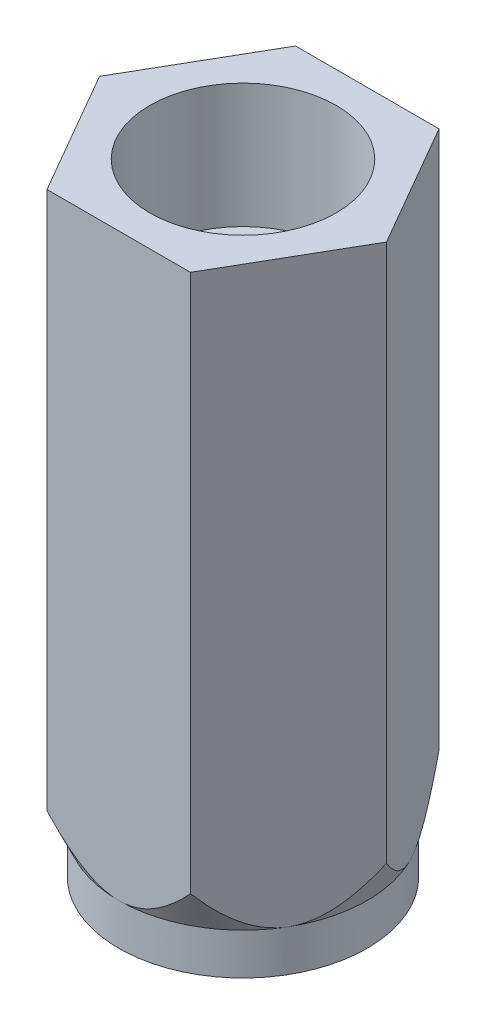
from build123d import *

# Parameters (mm, degrees)
SKETCH1_R           = 2.5
SKETCH1_R_2         = 1.7
BOSS_EXTRUDE1_DEPTH = 2
SKETCH2_R           = 3
SKETCH2_R_2         = 2.25
BOSS_EXTRUDE2_DEPTH = 15
BOSS_EXTRUDE3_DEPTH = 10
BOSS_EXTRUDE4_START = -13
BOSS_EXTRUDE4_DEPTH = 13
CHAMFER1_SIZE       = 1
CHAMFER1_SIZE_2     = 0.46
SKETCH3_R           = 0.5
CUT_EXTRUDE1_DEPTH  = 16.684387141


with BuildPart() as part:
    # Sketch1 → Boss-Extrude1 (new body)
    with BuildSketch(Plane(origin=(0, 0, 0), x_dir=(1, 0, 0), z_dir=(0, 1, 0))):
        with Locations(Location((0, 0, 0), (0, 0, 270))):
            Circle(SKETCH1_R)
        with Locations(Location((0, 0, 0), (0, 0, 270))):
            Circle(SKETCH1_R_2, mode=Mode.SUBTRACT)
    extrude(amount=BOSS_EXTRUDE1_DEPTH)

    # Sketch2 → Boss-Extrude2 (add)
    with BuildSketch(Plane.XZ):
        with Locations(Location((0, 0, 0), (0, 0, 270))):
            Circle(SKETCH2_R)
        with Locations(Location((0, 0, 0), (0, 0, 270))):
            Circle(SKETCH2_R_2, mode=Mode.SUBTRACT)
    extrude(amount=-BOSS_EXTRUDE2_DEPTH)

    # Sketch4 → Boss-Extrude3 (add)
    with BuildSketch(Plane(origin=(0, 2, 0), x_dir=(1, 0, 0), z_dir=(0, 1, 0))):
        with BuildLine():
            Line((-2.25, 0), (-1.7, 0))
            ThreePointArc((-1.7, 0), (0, 1.7), (1.7, 0))
            Line((1.7, 0), (2.25, 0))
            ThreePointArc((2.25, 0), (0, 2.25), (-2.25, 0))
        make_face()
    extrude(amount=BOSS_EXTRUDE3_DEPTH)

    # Sketch5 → Boss-Extrude4 (add)
    with BuildSketch(Plane(origin=(0, 15, 0), x_dir=(1, 0, 0), z_dir=(0, 1, 0)).offset(BOSS_EXTRUDE4_START)):
        with BuildLine():
            ThreePointArc((3, 0), (2.897777479, -0.776457134), (2.598076213, -1.499999997))
            Line((2.598076213, -1.499999997), (3.464101615, 0))
            Line((3.464101615, 0), (2.598076175, 1.500000063))
            ThreePointArc((2.598076175, 1.500000063), (2.897777469, 0.776457171), (3, 0))
        make_face()
        with BuildLine():
            ThreePointArc((0, 3), (1.499999968, 2.59807623), (2.598076175, 1.500000063))
            Line((2.598076175, 1.500000063), (1.732050808, 3))
            Line((1.732050808, 3), (0, 3))
        make_face()
        with BuildLine():
            Line((0, -3), (1.732050808, -3))
            Line((1.732050808, -3), (2.598076213, -1.499999997))
            ThreePointArc((2.598076213, -1.499999997), (1.500000001, -2.598076211), (0, -3))
        make_face()
        with BuildLine():
            Line((-1.732050808, -3), (0, -3))
            ThreePointArc((0, -3), (-1.500000022, -2.598076199), (-2.598076237, -1.499999956))
            Line((-2.598076237, -1.499999956), (-1.732050808, -3))
        make_face()
        with BuildLine():
            Line((-1.732050808, 3), (-2.598076213, 1.499999997))
            ThreePointArc((-2.598076213, 1.499999997), (-1.500000001, 2.598076211), (0, 3))
            Line((0, 3), (-1.732050808, 3))
        make_face()
        with BuildLine():
            Line((-3.464101615, 0), (-2.598076237, -1.499999956))
            ThreePointArc((-2.598076237, -1.499999956), (-3, 2.4e-08), (-2.598076213, 1.499999997))
            Line((-2.598076213, 1.499999997), (-3.464101615, 0))
        make_face()
    extrude(amount=BOSS_EXTRUDE4_DEPTH)

    # Chamfer1
    # the kernel refuses this chamfer: 1, 0.46 mm, written as the material it adds along each edge
    with BuildSketch(Plane(origin=(0, 2, 0), x_dir=(0.8660253915691799, 0, -0.5000000211574483), z_dir=(-0.5000000211574483, 0, -0.8660253915691799))) as chamfer1_piece_1_section:
        Polygon((3, CHAMFER1_SIZE), (3 + CHAMFER1_SIZE_2, 0), (3, 0), align=None)
    chamfer1_piece_1 = revolve(axis=Axis((0, 2, 0), (0, -1, 0)), revolution_arc=60.00000134, mode=Mode.PRIVATE)
    chamfer1_piece_1 = split(chamfer1_piece_1, bisect_by=Plane(origin=(3.362009453, 1.613138891, 0.176828812), z_dir=(-0.8660254037844387, 0, -0.4999999999999999)), keep=Keep.TOP, mode=Mode.PRIVATE)
    chamfer1_piece_1 = split(chamfer1_piece_1, bisect_by=Plane(origin=(3.362009453, 1.613138891, -0.176828812), z_dir=(-0.8660254037844383, 0, 0.5000000000000009)), keep=Keep.TOP, mode=Mode.PRIVATE)
    add(chamfer1_piece_1)
    with BuildSketch(Plane(origin=(0, 2, 0), x_dir=(0, 0, -1), z_dir=(-1, 0, 0))) as chamfer1_piece_2_section:
        Polygon((3, CHAMFER1_SIZE), (3 + CHAMFER1_SIZE_2, 0), (3, 0), align=None)
    chamfer1_piece_2 = revolve(axis=Axis((0, 2, 0), (0, -1, 0)), revolution_arc=59.9999986, mode=Mode.PRIVATE)
    chamfer1_piece_2 = split(chamfer1_piece_2, bisect_by=Plane(origin=(1.527866484, 1.613138891, -3), z_dir=(0, 0, 1)), keep=Keep.TOP, mode=Mode.PRIVATE)
    chamfer1_piece_2 = split(chamfer1_piece_2, bisect_by=Plane(origin=(1.83414297, 1.613138891, -2.823171188), z_dir=(-0.8660254037844383, 0, 0.5000000000000009)), keep=Keep.TOP, mode=Mode.PRIVATE)
    add(chamfer1_piece_2)
    with BuildSketch(Plane(origin=(0, 2, 0), x_dir=(0.8660254043088125, 0, 0.4999999990917579), z_dir=(0.4999999990917579, 0, -0.8660254043088125))) as chamfer1_piece_3_section:
        Polygon((3, CHAMFER1_SIZE), (3 + CHAMFER1_SIZE_2, 0), (3, 0), align=None)
    chamfer1_piece_3 = revolve(axis=Axis((0, 2, 0), (0, -1, 0)), revolution_arc=60.00000006, mode=Mode.PRIVATE)
    chamfer1_piece_3 = split(chamfer1_piece_3, bisect_by=Plane(origin=(1.527866484, 1.613138891, 3), z_dir=(0, 0, -1)), keep=Keep.TOP, mode=Mode.PRIVATE)
    chamfer1_piece_3 = split(chamfer1_piece_3, bisect_by=Plane(origin=(1.83414297, 1.613138891, 2.823171188), z_dir=(-0.8660254037844387, 0, -0.4999999999999999)), keep=Keep.TOP, mode=Mode.PRIVATE)
    add(chamfer1_piece_3)
    with BuildSketch(Plane(origin=(0, 2, 0), x_dir=(0, 0, 1), z_dir=(1, 0, 0))) as chamfer1_piece_4_section:
        Polygon((3, CHAMFER1_SIZE), (3 + CHAMFER1_SIZE_2, 0), (3, 0), align=None)
    chamfer1_piece_4 = revolve(axis=Axis((0, 2, 0), (0, -1, 0)), revolution_arc=60.000000962, mode=Mode.PRIVATE)
    chamfer1_piece_4 = split(chamfer1_piece_4, bisect_by=Plane(origin=(-1.83414297, 1.613138891, 2.823171188), z_dir=(0.8660254037844383, 0, -0.5000000000000007)), keep=Keep.TOP, mode=Mode.PRIVATE)
    chamfer1_piece_4 = split(chamfer1_piece_4, bisect_by=Plane(origin=(-1.527866484, 1.613138891, 3), z_dir=(0, 0, -1)), keep=Keep.TOP, mode=Mode.PRIVATE)
    add(chamfer1_piece_4)
    with BuildSketch(Plane(origin=(0, 2, 0), x_dir=(-0.8660254043087933, 0, -0.4999999990917912), z_dir=(-0.4999999990917912, 0, 0.8660254043087933))) as chamfer1_piece_5_section:
        Polygon((3, CHAMFER1_SIZE), (3 + CHAMFER1_SIZE_2, 0), (3, 0), align=None)
    chamfer1_piece_5 = revolve(axis=Axis((0, 2, 0), (0, -1, 0)), revolution_arc=60.00000006, mode=Mode.PRIVATE)
    chamfer1_piece_5 = split(chamfer1_piece_5, bisect_by=Plane(origin=(-1.527866484, 1.613138891, -3), z_dir=(0, 0, 1)), keep=Keep.TOP, mode=Mode.PRIVATE)
    chamfer1_piece_5 = split(chamfer1_piece_5, bisect_by=Plane(origin=(-1.83414297, 1.613138891, -2.823171188), z_dir=(0.8660254037844388, 0, 0.4999999999999996)), keep=Keep.TOP, mode=Mode.PRIVATE)
    add(chamfer1_piece_5)
    with BuildSketch(Plane(origin=(0, 2, 0), x_dir=(-0.8660254121823108, 0, 0.4999999854544585), z_dir=(0.4999999854544585, 0, 0.8660254121823108))) as chamfer1_piece_6_section:
        Polygon((3, CHAMFER1_SIZE), (3 + CHAMFER1_SIZE_2, 0), (3, 0), align=None)
    chamfer1_piece_6 = revolve(axis=Axis((0, 2, 0), (0, -1, 0)), revolution_arc=59.999998978, mode=Mode.PRIVATE)
    chamfer1_piece_6 = split(chamfer1_piece_6, bisect_by=Plane(origin=(-3.362009453, 1.613138891, -0.176828812), z_dir=(0.8660254037844388, 0, 0.4999999999999996)), keep=Keep.TOP, mode=Mode.PRIVATE)
    chamfer1_piece_6 = split(chamfer1_piece_6, bisect_by=Plane(origin=(-3.362009453, 1.613138891, 0.176828812), z_dir=(0.8660254037844383, 0, -0.5000000000000007)), keep=Keep.TOP, mode=Mode.PRIVATE)
    add(chamfer1_piece_6)

    # Sketch3 → Cut-Extrude1 (cut, through all)
    with BuildSketch(Plane.XY):
        with Locations((0, 4.5)):
            Circle(SKETCH3_R)
    extrude(amount=-CUT_EXTRUDE1_DEPTH, mode=Mode.SUBTRACT)


solid = part.part
